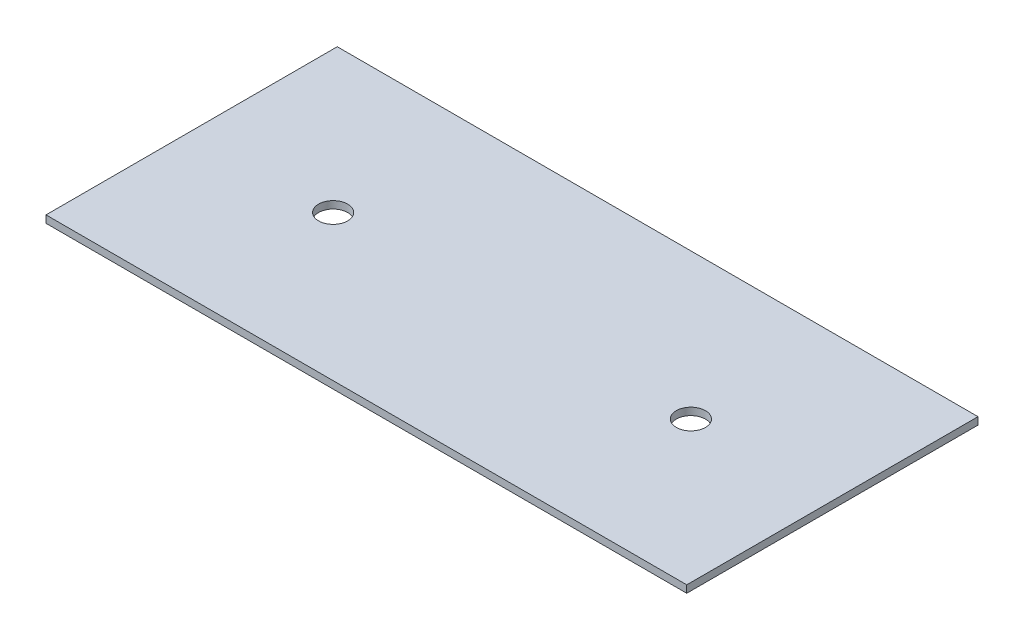
from build123d import *

# Parameters (mm, degrees)
SKETCH1_W           = 139.7
SKETCH1_H           = 63.5
SKETCH1_R           = 3.175
BOSS_EXTRUDE1_DEPTH = 1.6


with BuildPart() as part:
    # Sketch1 → Boss-Extrude1 (new body)
    with BuildSketch(Plane(origin=(0, 0, 0), x_dir=(1, 0, 0), z_dir=(0, 1, 0))):
        Rectangle(SKETCH1_W, SKETCH1_H)
        with Locations((39, 0)):
            Circle(SKETCH1_R, mode=Mode.SUBTRACT)
        with Locations((-39, 0)):
            Circle(SKETCH1_R, mode=Mode.SUBTRACT)
    extrude(amount=BOSS_EXTRUDE1_DEPTH)


solid = part.part
